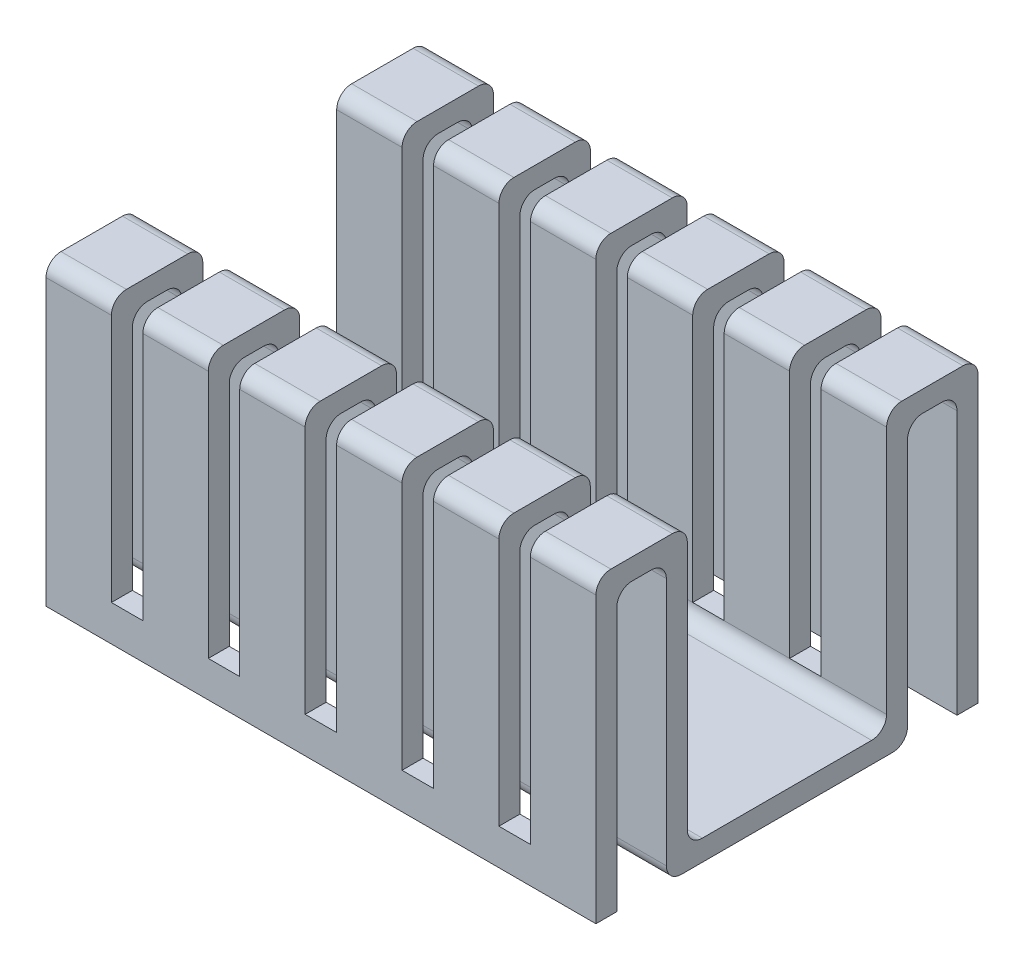
from build123d import *

# Parameters (mm, degrees)
SALIENTE_EXTRUIR1_DEPTH = 36.7
CROQUIS2_R              = 1.675
CROQUIS2_W              = 5.125
CROQUIS2_H              = 10.25
CORTAR_EXTRUIR1_DEPTH   = 49.405578191
CROQUIS3_W              = 2.1
CROQUIS3_H              = 17.6
CORTAR_EXTRUIR2_DEPTH   = 49.960596402


with BuildPart() as part:
    # Croquis1 → Saliente-Extruir1 (new body)
    with BuildSketch(Plane(origin=(0, 0, 0), x_dir=(0, 0, -1), z_dir=(1, 0, 0))):
        with BuildLine():
            Line((0, 0), (0, 19))
            ThreePointArc((0, 19), (-0.292893219, 19.707106781), (-1, 20))
            Line((-1, 20), (-5.1, 20))
            ThreePointArc((-5.1, 20), (-5.807106781, 19.707106781), (-6.1, 19))
            Line((-6.1, 19), (-6.1, 2.4))
            ThreePointArc((-6.1, 2.4), (-6.392893219, 1.692893219), (-7.1, 1.4))
            Line((-7.1, 1.4), (-18.4, 1.4))
            ThreePointArc((-18.4, 1.4), (-19.107106781, 1.692893219), (-19.4, 2.4))
            Line((-19.4, 2.4), (-19.4, 19))
            ThreePointArc((-19.4, 19), (-19.692893219, 19.707106781), (-20.4, 20))
            Line((-20.4, 20), (-24.5, 20))
            ThreePointArc((-24.5, 20), (-25.207106781, 19.707106781), (-25.5, 19))
            Line((-25.5, 19), (-25.5, 0))
            Line((-25.5, 0), (-24.1, 0))
            Line((-24.1, 0), (-24.1, 17.6))
            ThreePointArc((-24.1, 17.6), (-23.807106781, 18.307106781), (-23.1, 18.6))
            Line((-23.1, 18.6), (-21.8, 18.6))
            ThreePointArc((-21.8, 18.6), (-21.092893219, 18.307106781), (-20.8, 17.6))
            Line((-20.8, 17.6), (-20.8, 1))
            ThreePointArc((-20.8, 1), (-20.507106781, 0.292893219), (-19.8, 0))
            Line((-19.8, 0), (-5.7, 0))
            ThreePointArc((-5.7, 0), (-4.992893219, 0.292893219), (-4.7, 1))
            Line((-4.7, 1), (-4.7, 17.6))
            ThreePointArc((-4.7, 17.6), (-4.407106781, 18.307106781), (-3.7, 18.6))
            Line((-3.7, 18.6), (-2.4, 18.6))
            ThreePointArc((-2.4, 18.6), (-1.692893219, 18.307106781), (-1.4, 17.6))
            Line((-1.4, 17.6), (-1.4, 0))
            Line((-1.4, 0), (0, 0))
        make_face()
    extrude(amount=SALIENTE_EXTRUIR1_DEPTH)

    # Croquis2 → Cortar-Extruir1 (cut, through all)
    with BuildSketch(Plane(origin=(0, 1.4, 0), x_dir=(1, 0, 0), z_dir=(0, 1, 0))):
        with Locations((18.4, -12.75)):
            Circle(CROQUIS2_R)
        with Locations((2.5625, -12.75)):
            Rectangle(CROQUIS2_W, CROQUIS2_H)
    extrude(amount=-CORTAR_EXTRUIR1_DEPTH, mode=Mode.SUBTRACT)

    # Croquis3 → Cortar-Extruir2 (cut, through all)
    with BuildSketch(Plane.XY.offset(25.5)):
        with Locations((5.415, 11.2)):
            Rectangle(CROQUIS3_W, CROQUIS3_H)
        with Locations((11.88, 11.2)):
            Rectangle(CROQUIS3_W, CROQUIS3_H)
        with Locations((18.345, 11.2)):
            Rectangle(CROQUIS3_W, CROQUIS3_H)
        with Locations((24.81, 11.2)):
            Rectangle(CROQUIS3_W, CROQUIS3_H)
        with Locations((31.275, 11.2)):
            Rectangle(CROQUIS3_W, CROQUIS3_H)
    extrude(amount=-CORTAR_EXTRUIR2_DEPTH, mode=Mode.SUBTRACT)


solid = part.part
